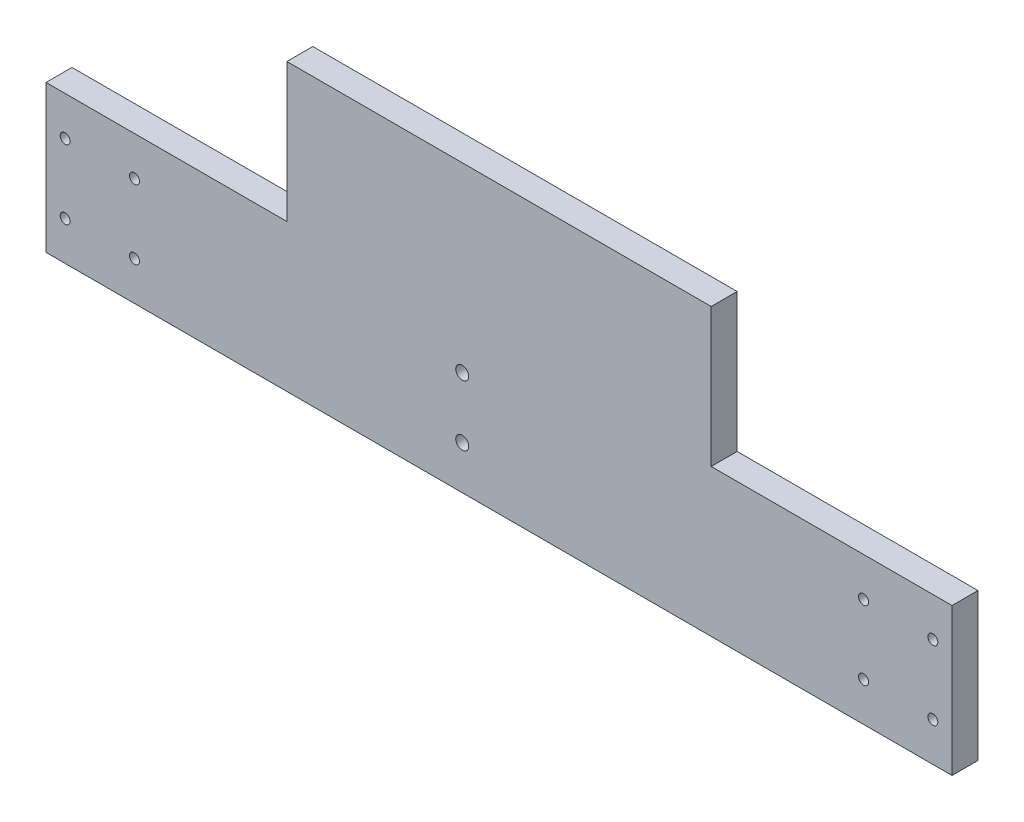
from build123d import *

# Parameters (mm, degrees)
BOSS_EXTRU_1_DEPTH      = 6
ESQUISSE2_R             = 1.15
ESQUISSE2_R_2           = 1.5
ENL_V_MAT_EXTRU_1_DEPTH = 6


with BuildPart() as part:
    # Esquisse1 → Boss.-Extru.1 (new body)
    with BuildSketch(Plane.XY):
        Polygon((-104.63, 17), (-49, 17), (-49, 49), (49, 49), (49, 17), (104.63, 17), (104.63, -17), (-104.63, -17), align=None)
    extrude(amount=BOSS_EXTRU_1_DEPTH)

    # Esquisse2 → Enlèv. mat.-Extru.1 (cut)
    with BuildSketch(Plane.XY.offset(6)):
        with Locations((-100.2, 8)):
            Circle(ESQUISSE2_R)
        with Locations((-84.2, 8)):
            Circle(ESQUISSE2_R)
        with Locations((-84.2, -8)):
            Circle(ESQUISSE2_R)
        with Locations((-100.2, -8)):
            Circle(ESQUISSE2_R)
        with Locations((100.2, -8)):
            Circle(ESQUISSE2_R)
        with Locations((84.2, -8)):
            Circle(ESQUISSE2_R)
        with Locations((84.2, 8)):
            Circle(ESQUISSE2_R)
        with Locations((100.2, 8)):
            Circle(ESQUISSE2_R)
        with Locations((-8.5, 7)):
            Circle(ESQUISSE2_R_2)
        with Locations((-8.5, -7)):
            Circle(ESQUISSE2_R_2)
    extrude(amount=-ENL_V_MAT_EXTRU_1_DEPTH, mode=Mode.SUBTRACT)


solid = part.part
